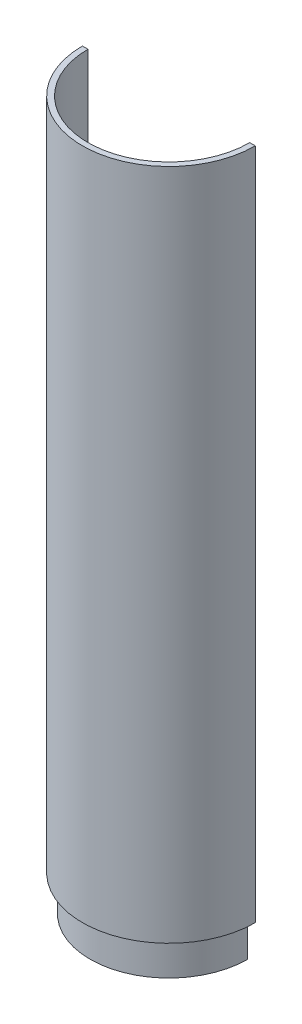
from build123d import *
from build123d.topology import SkipClean

# Parameters (mm, degrees)
BOSS_EXTRUDE1_DEPTH      = 3.81
BOSS_EXTRUDE1_DEPTH_BACK = 6.35
SKETCH1_R                = 49.4538
SKETCH2_R                = 49.4538
BOSS_EXTRUDE2_DEPTH      = 381
SHELL1_T                 = -3.175
CUT_EXTRUDE1_DEPTH       = 398.363186857
BOSS_EXTRUDE3_DEPTH      = 3.81
SKETCH7_R                = 49.4538
SKETCH7_R_2              = 45.085
CUT_EXTRUDE2_DEPTH       = 6.35
BOSS_EXTRUDE4_START      = 7.62
BOSS_EXTRUDE4_DEPTH      = 7.62
SKETCH10_R               = 35.56
CUT_EXTRUDE3_DEPTH       = 6.35
SKETCH11_R               = 8.382
CUT_EXTRUDE4_DEPTH       = 5.08
SKETCH12_R               = 6.0325
CUT_EXTRUDE5_DEPTH       = 402.739558289
BOSS_EXTRUDE5_DEPTH      = 5.08
SKETCH14_R               = 4.191
CUT_EXTRUDE6_DEPTH       = 405.866453376
BOSS_EXTRUDE6_START      = 6.35
SKETCH15_R               = 4.191
SKETCH15_R_2             = 6.0325
BOSS_EXTRUDE6_DEPTH      = 6.35


with BuildPart() as part:
    # Sketch1 → Boss-Extrude1 (new, two sides: drawn at the far end of the back side and taken through both)
    with BuildSketch(Plane(origin=(0, 0, 0), x_dir=(1, 0, 0), z_dir=(0, 1, 0)).offset(-BOSS_EXTRUDE1_DEPTH_BACK)):
        Circle(SKETCH1_R)
    extrude(amount=BOSS_EXTRUDE1_DEPTH + BOSS_EXTRUDE1_DEPTH_BACK)

    # Sketch2 → Boss-Extrude2 (add)
    with BuildSketch(Plane(origin=(0, 3.81, 0), x_dir=(1, 0, 0), z_dir=(0, 1, 0))):
        Circle(SKETCH2_R)
    extrude(amount=BOSS_EXTRUDE2_DEPTH)

    # Shell1
    shell1_openings = [part.faces().sort_by_distance(p)[0] for p in [
        (0, 384.81, 0),
    ]]
    offset(amount=SHELL1_T, openings=shell1_openings, kind=Kind.INTERSECTION)

    # Sketch4 → Cut-Extrude1 (cut, through all)
    with BuildSketch(Plane.XZ.offset(6.35)):
        with BuildLine():
            Line((49.4538, 0), (12.7, 0))
            ThreePointArc((12.7, 0), (0, -12.7), (-12.7, 0))
            Line((-12.7, 0), (-49.4538, 0))
            ThreePointArc((-49.4538, 0), (0, -49.4538), (49.4538, 0))
        make_face()
    extrude(amount=-CUT_EXTRUDE1_DEPTH, mode=Mode.SUBTRACT)

    # Sketch5 → Boss-Extrude3 (add)
    with BuildSketch(Plane(origin=(0, -3.175, 0), x_dir=(1, 0, 0), z_dir=(0, 1, 0))):
        with BuildLine():
            Line((-46.2788, 0), (-12.7, 0))
            ThreePointArc((-12.7, 0), (0, 12.7), (12.7, 0))
            Line((12.7, 0), (46.2788, 0))
            ThreePointArc((46.2788, 0), (0, -46.2788), (-46.2788, 0))
        make_face()
    extrude(amount=BOSS_EXTRUDE3_DEPTH)

    # Sketch7 → Cut-Extrude2 (cut)
    with BuildSketch(Plane.XZ.offset(6.35)):
        Circle(SKETCH7_R)
        Circle(SKETCH7_R_2, mode=Mode.SUBTRACT)
    extrude(amount=-CUT_EXTRUDE2_DEPTH, mode=Mode.SUBTRACT)

    # Sketch9 → Boss-Extrude4 (add)
    with SkipClean():  # the faces are left unmerged after this step: merging them gives an invalid solid
        with BuildSketch(Plane.XZ.offset(6.35).offset(BOSS_EXTRUDE4_START)):
            with BuildLine():
                Line((45.085, 0), (12.7, 0))
                ThreePointArc((12.7, 0), (0, -12.7), (-12.7, 0))
                Line((-12.7, 0), (-45.085, 0))
                ThreePointArc((-45.085, 0), (0, 45.085), (45.085, 0))
            make_face()
        extrude(amount=-BOSS_EXTRUDE4_DEPTH)
    add(part.part.scale(1), mode=Mode.REPLACE)  # the faces are merged on a copy

    # Sketch10 → Cut-Extrude3 (cut)
    with BuildSketch(Plane(origin=(0, 0.635, 0), x_dir=(1, 0, 0), z_dir=(0, 1, 0))):
        Circle(SKETCH10_R)
    extrude(amount=-CUT_EXTRUDE3_DEPTH, mode=Mode.SUBTRACT)

    # Sketch11 → Cut-Extrude4 (cut)
    with BuildSketch(Plane(origin=(0, -5.715, 0), x_dir=(1, 0, 0), z_dir=(0, 1, 0))):
        Circle(SKETCH11_R)
    cut_extrude4 = extrude(amount=-CUT_EXTRUDE4_DEPTH, mode=Mode.SUBTRACT)

    # Sketch12 → Cut-Extrude5 (cut, through all)
    with BuildSketch(Plane(origin=(0, -10.795, 0), x_dir=(1, 0, 0), z_dir=(0, 1, 0))):
        Circle(SKETCH12_R)
    extrude(amount=-CUT_EXTRUDE5_DEPTH, mode=Mode.SUBTRACT)

    # Sketch13 → Boss-Extrude5 (add)
    with SkipClean():  # the faces are left unmerged after this step: merging them gives an invalid solid
        with BuildSketch(Plane(origin=(0, 0.635, 0), x_dir=(1, 0, 0), z_dir=(0, 1, 0))):
            with BuildLine():
                Line((-46.2788, 0), (-35.56, 0))
                ThreePointArc((-35.56, 0), (0, -35.56), (35.56, 0))
                Line((35.56, 0), (46.2788, 0))
                ThreePointArc((46.2788, 0), (0, -46.2788), (-46.2788, 0))
            make_face()
        extrude(amount=BOSS_EXTRUDE5_DEPTH)
    add(part.part.scale(1), mode=Mode.REPLACE)  # the faces are merged on a copy

    # Sketch14 → Cut-Extrude6 (cut, through all)
    with BuildSketch(Plane.XZ.offset(13.97)):
        with Locations((0, 15.24)):
            Circle(SKETCH14_R)
    extrude(amount=-CUT_EXTRUDE6_DEPTH, mode=Mode.SUBTRACT)

    # Sketch15 → Boss-Extrude6 (add)
    with BuildSketch(Plane.XZ.offset(13.97).offset(BOSS_EXTRUDE6_START)):
        with BuildLine():
            Line((12.7, 0), (45.085, 0))
            ThreePointArc((45.085, 0), (0, 45.085), (-45.085, 0))
            Line((-45.085, 0), (-12.7, 0))
            ThreePointArc((-12.7, 0), (0, -12.7), (12.7, 0))
        make_face()
        with Locations((0, 15.24)):
            Circle(SKETCH15_R, mode=Mode.SUBTRACT)
        Circle(SKETCH15_R_2, mode=Mode.SUBTRACT)
    extrude(amount=-BOSS_EXTRUDE6_DEPTH)

    # Mirror2: Cut-Extrude4 across plane
    add(cut_extrude4.mirror(Plane(origin=(0, -13.0175, 0), x_dir=(0, 0, 1), z_dir=(0, -1, 0))), mode=Mode.SUBTRACT)


solid = part.part
